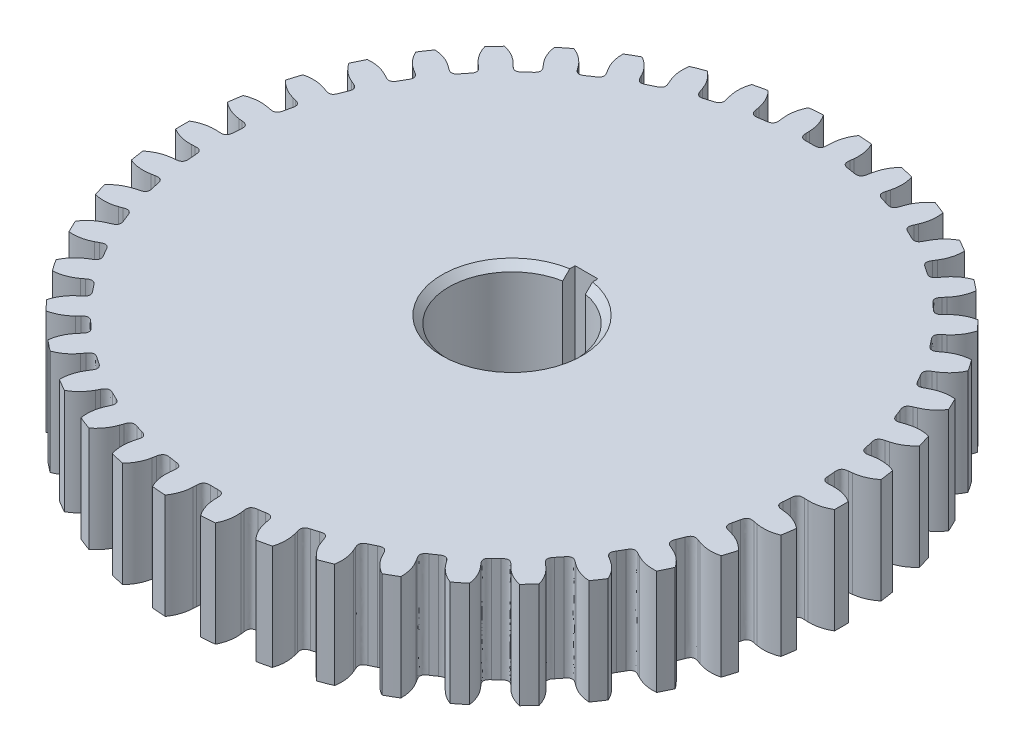
from build123d import *

# Parameters (mm, degrees)
BOSS_EXTRUDE1_DEPTH = 7.5
CIRPATTERN2_START   = -7.5
CIRPATTERN2_DEPTH   = 15
CUT_EXTRUDE1_DEPTH  = 69.092577484
CHAMFER1_SIZE       = 1


with BuildPart() as part:
    # Sketch1 → Boss-Extrude1 (new, symmetric)
    with BuildSketch(Plane(origin=(0, 0, 0), x_dir=(1, 0, 0), z_dir=(0, 1, 0))):
        with BuildLine():
            Line((42.338274669, 3.704119067), (0, 0))
            Line((0, 0), (42.338274669, -3.704119067))
            ThreePointArc((42.338274669, -3.704119067), (42.413791017, -2.705611121), (42.465761792, -1.705601183))
            Line((42.465761792, -1.705601183), (43.964553385, -1.765798871))
            ThreePointArc((43.964553385, -1.765798871), (45.534771559, -1.598199838), (46.989692123, -0.984293735))
            ThreePointArc((46.989692123, -0.984293735), (47, 0), (46.989692123, 0.984293735))
            ThreePointArc((46.989692123, 0.984293735), (45.534771559, 1.598199838), (43.964553385, 1.765798871))
            Line((43.964553385, 1.765798871), (42.465761792, 1.705601183))
            ThreePointArc((42.465761792, 1.705601183), (42.413791017, 2.705611121), (42.338274669, 3.704119067))
        make_face()
    extrude(amount=BOSS_EXTRUDE1_DEPTH, both=True)

    # Fillet1
    # a fillet whose section is not a circle: 1 mm, written as the material it adds along each edge
    with BuildSketch(Plane(origin=(42.465761792, 7.5, -1.705601183), x_dir=(-0.05161489294062093, 0, -0.9986670630529116), z_dir=(0, -1, 0))) as fillet1_piece_1:
        with BuildLine():
            add(Edge.make_bspline([(0.97707605, 0), (0.812105183, 0.001896467), (0.647134316, 0.003792935), (0.283944545, 0.077072663), (0.065709795, 0.295307413), (-0.007569933, 0.658497185), (-0.009466401, 0.823468051), (-0.011362868, 0.988438918)], knots=[0, 0, 0, 0, 0, 0, 0.5, 0.5, 1, 1, 1, 1, 1, 1], degree=5))
            Line((-0.011362868, 0.988438918), (0, 0))
            ThreePointArc((0, 0), (0.488538025, 0.002807968), (0.97707605, 0))
        make_face()
    extrude(amount=15)
    with BuildSketch(Plane(origin=(42.465761792, -7.5, 1.705601183), x_dir=(0.999194395114446, 0, 0.04013179253256076), z_dir=(0, 1, 0))) as fillet1_piece_2:
        with BuildLine():
            add(Edge.make_bspline([(0.988504228, 0), (0.823522461, 0), (0.658540694, 0), (0.294532568, -0.069100016), (0.073803625, -0.284811736), (-0.003646133, -0.64713516), (-0.007438817, -0.812073327), (-0.011231501, -0.977011494)], knots=[0, 0, 0, 0, 0, 0, 0.5, 0.5, 1, 1, 1, 1, 1, 1], degree=5))
            ThreePointArc((-0.011231501, -0.977011494), (-0.002807968, -0.488538025), (0, 0))
            Line((0, 0), (0.988504228, 0))
        make_face()
    extrude(amount=15)

    # CirPattern2: read off the stored shape, not the designer's step
    # CirPattern2 outline → CirPattern2 (add)
    with BuildSketch(Plane(origin=(0, 0, 0), x_dir=(1, 0, 0), z_dir=(0, 1, 0)).offset(CIRPATTERN2_START)):
        with BuildLine():
            add(Edge.make_bspline(
                [(42.338300191, -3.704121242), (42.324988157, -3.860312538), (42.314706675, -4.01940995), (42.357785402, -4.377977118), (42.554149821, -4.608731996), (42.900260677, -4.714580438), (43.064255119, -4.732602822), (43.228249561, -4.750625207)],
                knots=[0.020808919, 0.020808919, 0.020808919, 0.020808919, 0.020808919, 0.020808919, 0.5, 0.5, 1, 1, 1, 1, 1, 1], degree=5))
            Line((42.338300191, -3.704121242), (0, 0))
            Line((0, 0), (42.338300191, 3.704121242))
            add(Edge.make_bspline(
                [(43.228249561, 4.750625207), (43.064255119, 4.732602822), (42.900260677, 4.714580438), (42.554149821, 4.608731996), (42.357785402, 4.377977118), (42.314706675, 4.01940995), (42.324988157, 3.860312538), (42.338300191, 3.704121242)],
                knots=[0, 0, 0, 0, 0, 0, 0.5, 0.5, 0.979191081, 0.979191081, 0.979191081, 0.979191081, 0.979191081, 0.979191081], degree=5))
            Line((43.228249561, 4.750625207), (43.736684314, 4.806500311))
            ThreePointArc((43.736684314, 4.806500311), (45.264385109, 5.206256277), (46.611557455, 6.030150214))
            ThreePointArc((46.611557455, 6.030150214), (46.475048833, 7.00498651), (46.318154718, 7.976750188))
            ThreePointArc((46.318154718, 7.976750188), (44.787986458, 8.36695481), (43.210326983, 8.298653025))
            Line((43.210326983, 8.298653025), (42.708011084, 8.202181981))
            add(Edge.make_bspline(
                [(41.54194774, 8.973103031), (41.576412294, 8.813545659), (41.610309832, 8.652901378), (41.75556126, 8.308686255), (42.014344449, 8.139058355), (42.383969443, 8.139948961), (42.545990264, 8.171065471), (42.708011084, 8.202181981)],
                knots=[0, 0, 0, 0, 0, 0, 0.5, 0.5, 1, 1, 1, 1, 1, 1], degree=5))
            ThreePointArc((41.54194774, 8.973103031), (41.434436268, 9.457139693), (41.32128512, 9.939889136))
            add(Edge.make_bspline(
                [(42.037381784, 11.140400926), (41.877905121, 11.098137733), (41.718428458, 11.055874541), (41.385021426, 10.896302674), (41.225464616, 10.631191399), (41.243946947, 10.258042057), (41.283107262, 10.09859897), (41.32128512, 9.939889136)],
                knots=[0, 0, 0, 0, 0, 0, 0.5, 0.5, 1, 1, 1, 1, 1, 1], degree=5))
            Line((42.037381784, 11.140400926), (42.531809988, 11.271430219))
            ThreePointArc((42.531809988, 11.271430219), (43.982867092, 11.894413229), (45.192197617, 12.909890572))
            ThreePointArc((45.192197617, 12.909890572), (44.911921872, 13.853493197), (44.611946274, 14.791019223))
            ThreePointArc((44.611946274, 14.791019223), (43.040711748, 14.948805836), (41.490853279, 14.646128983))
            Line((41.490853279, 14.646128983), (41.008526097, 14.475869141))
            add(Edge.make_bspline(
                [(39.740586896, 15.064386916), (39.798447302, 14.911748344), (39.85590902, 14.757950493), (40.050840712, 14.43922857), (40.332015233, 14.310064906), (40.697379084, 14.366035312), (40.85295259, 14.420952226), (41.008526097, 14.475869141)],
                knots=[0, 0, 0, 0, 0, 0, 0.5, 0.5, 1, 1, 1, 1, 1, 1], degree=5))
            ThreePointArc((39.740586896, 15.064386916), (39.562134317, 15.526993536), (39.378296903, 15.987486763))
            add(Edge.make_bspline(
                [(39.907468361, 17.281318497), (39.756071923, 17.215758586), (39.604675485, 17.150198675), (39.298775286, 16.942717355), (39.18051338, 16.656786446), (39.254404301, 16.290559522), (39.316890987, 16.138733825), (39.378296903, 15.987486763)],
                knots=[0, 0, 0, 0, 0, 0, 0.5, 0.5, 1, 1, 1, 1, 1, 1], degree=5))
            Line((39.907468361, 17.281318497), (40.376845308, 17.484575001))
            ThreePointArc((40.376845308, 17.484575001), (41.718844504, 18.316868645), (42.763318761, 19.501245307))
            ThreePointArc((42.763318761, 19.501245307), (42.345536791, 20.392535738), (41.90918067, 21.27488133))
            ThreePointArc((41.90918067, 21.27488133), (40.33197866, 21.196725243), (38.844542474, 20.666434621))
            Line((38.844542474, 20.666434621), (38.392978401, 20.426189305))
            add(Edge.make_bspline(
                [(37.05148701, 20.819157291), (37.131450763, 20.676847212), (37.211193061, 20.53333138), (37.451450564, 20.247222379), (37.748735443, 20.161408254), (38.101676526, 20.271208173), (38.247327463, 20.348698739), (38.392978401, 20.426189305)],
                knots=[0, 0, 0, 0, 0, 0, 0.5, 0.5, 1, 1, 1, 1, 1, 1], degree=5))
            ThreePointArc((37.05148701, 20.819157291), (36.806079661, 21.25), (36.555662605, 21.677950353))
            add(Edge.make_bspline(
                [(36.886088041, 23.03619997), (36.746153774, 22.94880784), (36.606219506, 22.861415711), (36.334659446, 22.610659728), (36.260334218, 22.310296407), (36.38798313, 21.959172806), (36.472400337, 21.818356034), (36.555662605, 21.677950353)],
                knots=[0, 0, 0, 0, 0, 0, 0.5, 0.5, 1, 1, 1, 1, 1, 1], degree=5))
            Line((36.886088041, 23.03619997), (37.319928625, 23.30714327))
            ThreePointArc((37.319928625, 23.30714327), (38.522891868, 24.330155483), (39.379178029, 25.656974447))
            ThreePointArc((39.379178029, 25.656974447), (38.833222393, 26.476042729), (38.270233222, 27.283497744))
            ThreePointArc((38.270233222, 27.283497744), (36.722295816, 26.971144834), (35.330508779, 26.225086261))
            Line((35.330508779, 26.225086261), (34.91979501, 25.920222153))
            add(Edge.make_bspline(
                [(33.534718131, 26.108862095), (33.634998971, 25.98005948), (33.735240538, 25.850031575), (34.015456897, 25.602926697), (34.322211282, 25.562379058), (34.654845475, 25.723555741), (34.787320243, 25.821888947), (34.91979501, 25.920222153)],
                knots=[0, 0, 0, 0, 0, 0, 0.5, 0.5, 1, 1, 1, 1, 1, 1], degree=5))
            ThreePointArc((33.534718131, 26.108862095), (33.227838005, 26.498316579), (32.91643521, 26.884164355))
            add(Edge.make_bspline(
                [(33.040733466, 28.276490801), (32.91538727, 28.169218649), (32.790041074, 28.061946498), (32.558887355, 27.773517324), (32.530159109, 27.465431214), (32.708714545, 27.137254456), (32.813176532, 27.010592223), (32.91643521, 26.884164355)],
                knots=[0, 0, 0, 0, 0, 0, 0.5, 0.5, 1, 1, 1, 1, 1, 1], degree=5))
            Line((33.040733466, 28.276490801), (33.429346406, 28.609068473))
            ThreePointArc((33.429346406, 28.609068473), (34.466401484, 29.799946853), (35.115371532, 31.239569174))
            ThreePointArc((35.115371532, 31.239569174), (34.453437976, 31.968118675), (33.776392004, 32.682645903))
            ThreePointArc((33.776392004, 32.682645903), (32.292297566, 32.143073618), (31.0272499, 31.197912809))
            Line((31.0272499, 31.197912809), (30.666561102, 30.83524007))
            add(Edge.make_bspline(
                [(29.268839063, 30.815338063), (29.387196882, 30.702920151), (29.505698488, 30.58928478), (29.819614132, 30.386703941), (30.128985636, 30.392328554), (30.433882442, 30.60128158), (30.550221772, 30.718260825), (30.666561102, 30.83524007)],
                knots=[0, 0, 0, 0, 0, 0, 0.5, 0.5, 1, 1, 1, 1, 1, 1], degree=5))
            ThreePointArc((29.268839063, 30.815338063), (28.907341355, 31.154704553), (28.541909045, 31.48983055))
            add(Edge.make_bspline(
                [(28.457303504, 32.885131553), (28.349345406, 32.760375662), (28.241387307, 32.635619771), (28.055803523, 32.315960439), (28.073313999, 32.007033673), (28.298787326, 31.709134685), (28.420960586, 31.599456415), (28.541909045, 31.48983055)],
                knots=[0, 0, 0, 0, 0, 0, 0.5, 0.5, 1, 1, 1, 1, 1, 1], degree=5))
            Line((28.457303504, 32.885131553), (28.792007828, 33.271914361))
            ThreePointArc((28.792007828, 33.271914361), (29.639988646, 34.604056652), (30.067145661, 36.124323548))
            ThreePointArc((30.067145661, 36.124323548), (29.304020687, 36.746079676), (28.528042002, 37.351717759))
            ThreePointArc((28.528042002, 37.351717759), (27.140942749, 36.596979253), (26.030893529, 35.473829538))
            Line((26.030893529, 35.473829538), (25.728286894, 35.061449678))
            add(Edge.make_bspline(
                [(24.349142495, 34.833450299), (24.482933376, 34.73992832), (24.61704789, 34.64522391), (24.957650463, 34.491692431), (25.262728238, 34.543363651), (25.533076766, 34.795425356), (25.63068183, 34.928437517), (25.728286894, 35.061449678)],
                knots=[0, 0, 0, 0, 0, 0, 0.5, 0.5, 1, 1, 1, 1, 1, 1], degree=5))
            ThreePointArc((24.349142495, 34.833450299), (23.941102468, 35.115147908), (23.529803797, 35.392065965))
            add(Edge.make_bspline(
                [(23.238184406, 36.759172808), (23.150026011, 36.619720017), (23.061867616, 36.480267227), (22.9259994, 36.136518397), (22.989357444, 35.833651889), (23.256711961, 35.572685242), (23.393867344, 35.482440968), (23.529803797, 35.392065965)],
                knots=[0, 0, 0, 0, 0, 0, 0.5, 0.5, 1, 1, 1, 1, 1, 1], degree=5))
            Line((23.238184406, 36.759172808), (23.511503373, 37.191520662))
            ThreePointArc((23.511503373, 37.191520662), (24.15146744, 38.635169007), (24.347269441, 40.202120228))
            ThreePointArc((24.347269441, 40.202120228), (23.5, 40.703193978), (22.642422683, 41.186413962))
            ThreePointArc((22.642422683, 41.186413962), (21.38330412, 40.233368845), (20.453050012, 38.957319533))
            Line((20.453050012, 38.957319533), (20.215285271, 38.504444437))
            add(Edge.make_bspline(
                [(18.88552632, 38.073440817), (19.031761595, 38.000903897), (19.17849312, 37.927245988), (19.538174124, 37.826193508), (19.832143236, 37.922757086), (20.061904347, 38.212296828), (20.138594809, 38.358370632), (20.215285271, 38.504444437)],
                knots=[0, 0, 0, 0, 0, 0, 0.5, 0.5, 1, 1, 1, 1, 1, 1], degree=5))
            ThreePointArc((18.88552632, 38.073440817), (18.440058912, 38.291176886), (17.992081613, 38.503701111))
            add(Edge.make_bspline(
                [(17.499962668, 39.812074885), (17.433573289, 39.661040339), (17.367183911, 39.510005794), (17.284066335, 39.149846249), (17.391856633, 38.859805536), (17.695120081, 38.641600794), (17.844193763, 38.572806423), (17.992081613, 38.503701111)],
                knots=[0, 0, 0, 0, 0, 0, 0.5, 0.5, 1, 1, 1, 1, 1, 1], degree=5))
            Line((17.499962668, 39.812074885), (17.705790784, 40.280329848))
            ThreePointArc((17.705790784, 40.280329848), (18.12344236, 41.803235529), (18.083515453, 43.381867973))
            ThreePointArc((18.083515453, 43.381867973), (17.171028145, 43.751066186), (16.251009057, 44.101073736))
            ThreePointArc((16.251009057, 44.101073736), (15.147997812, 42.971011462), (14.418319155, 41.570567386))
            Line((14.418319155, 41.570567386), (14.25070758, 41.087313534))
            add(Edge.make_bspline(
                [(13.000038694, 40.462933581), (13.155451709, 40.413002075), (13.311522506, 40.362036063), (13.682247261, 40.315719928), (13.958540926, 40.455018794), (14.142582136, 40.775568732), (14.196644858, 40.931441133), (14.25070758, 41.087313534)],
                knots=[0, 0, 0, 0, 0, 0, 0.5, 0.5, 1, 1, 1, 1, 1, 1], degree=5))
            ThreePointArc((13.000038694, 40.462933581), (12.527094912, 40.611844246), (12.052446057, 40.755227199))
            add(Edge.make_bspline(
                [(11.370820682, 41.975640996), (11.327683349, 41.816398558), (11.284546016, 41.657156121), (11.25603579, 41.288631228), (11.405850484, 41.01789534), (11.738248459, 40.847326837), (11.89591038, 40.801519121), (12.052446057, 40.755227199)],
                knots=[0, 0, 0, 0, 0, 0, 0.5, 0.5, 1, 1, 1, 1, 1, 1], degree=5))
            Line((11.370820682, 41.975640996), (11.504560087, 42.469343028))
            ThreePointArc((11.504560087, 42.469343028), (11.690569526, 44.037486848), (11.415805613, 45.592536475))
            ThreePointArc((11.415805613, 45.592536475), (10.458483896, 45.821611873), (9.496574742, 46.030588397))
            ThreePointArc((9.496574742, 46.030588397), (8.574310263, 44.748752689), (8.061506873, 43.255197456))
            Line((8.061506873, 43.255197456), (7.96779263, 42.752359942))
            add(Edge.make_bspline(
                [(6.824151686, 41.948551271), (6.98527077, 41.922340567), (7.147194476, 41.895204949), (7.520681603, 41.904659784), (7.773127878, 42.083582231), (7.90733801, 42.42798181), (7.93756532, 42.590170876), (7.96779263, 42.752359942)],
                knots=[0, 0, 0, 0, 0, 0, 0.5, 0.5, 1, 1, 1, 1, 1, 1], degree=5))
            ThreePointArc((6.824151686, 41.948551271), (6.334296313, 42.025310115), (5.843578773, 42.096348857))
            add(Edge.make_bspline(
                [(4.987673351, 43.20154065), (4.968751681, 43.037647533), (4.94983001, 42.873754416), (4.976564004, 42.505096413), (5.165056483, 42.259713143), (5.519163763, 42.140591096), (5.681892017, 42.118793305), (5.843578773, 42.096348857)],
                knots=[0, 0, 0, 0, 0, 0, 0.5, 0.5, 1, 1, 1, 1, 1, 1], degree=5))
            Line((4.987673351, 43.20154065), (5.046336529, 43.709661262))
            ThreePointArc((5.046336529, 43.709661262), (4.996548687, 45.288013479), (4.49308554, 46.784743051))
            ThreePointArc((4.49308554, 46.784743051), (3.512314399, 46.868578468), (2.53000264, 46.931855777))
            ThreePointArc((2.53000264, 46.931855777), (1.809086793, 45.526880726), (1.524613849, 43.973577892))
            Line((1.524613849, 43.973577892), (1.50689036, 43.462389274))
            add(Edge.make_bspline(
                [(0.495824406, 42.497107645), (0.659050426, 42.495203246), (0.823209931, 42.492504186), (1.191116346, 42.557518786), (1.414075997, 42.772067982), (1.49545702, 43.132623885), (1.50117369, 43.29750658), (1.50689036, 43.462389274)],
                knots=[0, 0, 0, 0, 0, 0, 0.5, 0.5, 1, 1, 1, 1, 1, 1], degree=5))
            ThreePointArc((0.495824406, 42.497107645), (0, 42.5), (-0.495824406, 42.497107645))
            add(Edge.make_bspline(
                [(-1.50689036, 43.462389274), (-1.50117369, 43.29750658), (-1.49545702, 43.132623885), (-1.414075997, 42.772067982), (-1.191116346, 42.557518786), (-0.823209931, 42.492504186), (-0.659050426, 42.495203246), (-0.495824406, 42.497107645)],
                knots=[0, 0, 0, 0, 0, 0, 0.5, 0.5, 1, 1, 1, 1, 1, 1], degree=5))
            Line((-1.50689036, 43.462389274), (-1.524613849, 43.973577892))
            ThreePointArc((-1.524613849, 43.973577892), (-1.809086793, 45.526880726), (-2.53000264, 46.931855777))
            ThreePointArc((-2.53000264, 46.931855777), (-3.512314399, 46.868578468), (-4.49308554, 46.784743051))
            ThreePointArc((-4.49308554, 46.784743051), (-4.996548687, 45.288013479), (-5.046336529, 43.709661262))
            Line((-5.046336529, 43.709661262), (-4.987673351, 43.20154065))
            add(Edge.make_bspline(
                [(-5.843578773, 42.096348857), (-5.681892017, 42.118793305), (-5.519163763, 42.140591096), (-5.165056483, 42.259713143), (-4.976564004, 42.505096413), (-4.94983001, 42.873754416), (-4.968751681, 43.037647533), (-4.987673351, 43.20154065)],
                knots=[0, 0, 0, 0, 0, 0, 0.5, 0.5, 1, 1, 1, 1, 1, 1], degree=5))
            ThreePointArc((-5.843578773, 42.096348857), (-6.334296313, 42.025310115), (-6.824151686, 41.948551271))
            add(Edge.make_bspline(
                [(-7.96779263, 42.752359942), (-7.93756532, 42.590170876), (-7.90733801, 42.42798181), (-7.773127878, 42.083582231), (-7.520681603, 41.904659784), (-7.147194476, 41.895204949), (-6.98527077, 41.922340567), (-6.824151686, 41.948551271)],
                knots=[0, 0, 0, 0, 0, 0, 0.5, 0.5, 1, 1, 1, 1, 1, 1], degree=5))
            Line((-7.96779263, 42.752359942), (-8.061506873, 43.255197456))
            ThreePointArc((-8.061506873, 43.255197456), (-8.574310263, 44.748752689), (-9.496574742, 46.030588397))
            ThreePointArc((-9.496574742, 46.030588397), (-10.458483896, 45.821611873), (-11.415805613, 45.592536475))
            ThreePointArc((-11.415805613, 45.592536475), (-11.690569526, 44.037486848), (-11.504560087, 42.469343028))
            Line((-11.504560087, 42.469343028), (-11.370820682, 41.975640996))
            add(Edge.make_bspline(
                [(-12.052446057, 40.755227199), (-11.89591038, 40.801519121), (-11.738248459, 40.847326837), (-11.405850484, 41.01789534), (-11.25603579, 41.288631228), (-11.284546016, 41.657156121), (-11.327683349, 41.816398558), (-11.370820682, 41.975640996)],
                knots=[0, 0, 0, 0, 0, 0, 0.5, 0.5, 1, 1, 1, 1, 1, 1], degree=5))
            ThreePointArc((-12.052446057, 40.755227199), (-12.527094912, 40.611844246), (-13.000038694, 40.462933581))
            add(Edge.make_bspline(
                [(-14.25070758, 41.087313534), (-14.196644858, 40.931441133), (-14.142582136, 40.775568732), (-13.958540926, 40.455018794), (-13.682247261, 40.315719928), (-13.311522506, 40.362036063), (-13.155451709, 40.413002075), (-13.000038694, 40.462933581)],
                knots=[0, 0, 0, 0, 0, 0, 0.5, 0.5, 1, 1, 1, 1, 1, 1], degree=5))
            Line((-14.25070758, 41.087313534), (-14.418319155, 41.570567386))
            ThreePointArc((-14.418319155, 41.570567386), (-15.147997812, 42.971011462), (-16.251009057, 44.101073736))
            ThreePointArc((-16.251009057, 44.101073736), (-17.171028145, 43.751066186), (-18.083515453, 43.381867973))
            ThreePointArc((-18.083515453, 43.381867973), (-18.12344236, 41.803235529), (-17.705790784, 40.280329848))
            Line((-17.705790784, 40.280329848), (-17.499962668, 39.812074885))
            add(Edge.make_bspline(
                [(-17.992081613, 38.503701111), (-17.844193763, 38.572806423), (-17.695120081, 38.641600794), (-17.391856633, 38.859805536), (-17.284066335, 39.149846249), (-17.367183911, 39.510005794), (-17.433573289, 39.661040339), (-17.499962668, 39.812074885)],
                knots=[0, 0, 0, 0, 0, 0, 0.5, 0.5, 1, 1, 1, 1, 1, 1], degree=5))
            ThreePointArc((-17.992081613, 38.503701111), (-18.440058912, 38.291176886), (-18.88552632, 38.073440817))
            add(Edge.make_bspline(
                [(-20.215285271, 38.504444437), (-20.138594809, 38.358370632), (-20.061904347, 38.212296828), (-19.832143236, 37.922757086), (-19.538174124, 37.826193508), (-19.17849312, 37.927245988), (-19.031761595, 38.000903897), (-18.88552632, 38.073440817)],
                knots=[0, 0, 0, 0, 0, 0, 0.5, 0.5, 1, 1, 1, 1, 1, 1], degree=5))
            Line((-20.215285271, 38.504444437), (-20.453050012, 38.957319533))
            ThreePointArc((-20.453050012, 38.957319533), (-21.38330412, 40.233368845), (-22.642422683, 41.186413962))
            ThreePointArc((-22.642422683, 41.186413962), (-23.5, 40.703193978), (-24.347269441, 40.202120228))
            ThreePointArc((-24.347269441, 40.202120228), (-24.15146744, 38.635169007), (-23.511503373, 37.191520662))
            Line((-23.511503373, 37.191520662), (-23.238184406, 36.759172808))
            add(Edge.make_bspline(
                [(-23.529803797, 35.392065965), (-23.393867344, 35.482440968), (-23.256711961, 35.572685242), (-22.989357444, 35.833651889), (-22.9259994, 36.136518397), (-23.061867616, 36.480267227), (-23.150026011, 36.619720017), (-23.238184406, 36.759172808)],
                knots=[0, 0, 0, 0, 0, 0, 0.5, 0.5, 1, 1, 1, 1, 1, 1], degree=5))
            ThreePointArc((-23.529803797, 35.392065965), (-23.941102468, 35.115147908), (-24.349142495, 34.833450299))
            add(Edge.make_bspline(
                [(-25.728286894, 35.061449678), (-25.63068183, 34.928437517), (-25.533076766, 34.795425356), (-25.262728238, 34.543363651), (-24.957650463, 34.491692431), (-24.61704789, 34.64522391), (-24.482933376, 34.73992832), (-24.349142495, 34.833450299)],
                knots=[0, 0, 0, 0, 0, 0, 0.5, 0.5, 1, 1, 1, 1, 1, 1], degree=5))
            Line((-25.728286894, 35.061449678), (-26.030893529, 35.473829538))
            ThreePointArc((-26.030893529, 35.473829538), (-27.140942749, 36.596979253), (-28.528042002, 37.351717759))
            ThreePointArc((-28.528042002, 37.351717759), (-29.304020687, 36.746079676), (-30.067145661, 36.124323548))
            ThreePointArc((-30.067145661, 36.124323548), (-29.639988646, 34.604056652), (-28.792007828, 33.271914361))
            Line((-28.792007828, 33.271914361), (-28.457303504, 32.885131553))
            add(Edge.make_bspline(
                [(-28.541909045, 31.48983055), (-28.420960586, 31.599456415), (-28.298787326, 31.709134685), (-28.073313999, 32.007033673), (-28.055803523, 32.315960439), (-28.241387307, 32.635619771), (-28.349345406, 32.760375662), (-28.457303504, 32.885131553)],
                knots=[0, 0, 0, 0, 0, 0, 0.5, 0.5, 1, 1, 1, 1, 1, 1], degree=5))
            ThreePointArc((-28.541909045, 31.48983055), (-28.907341355, 31.154704553), (-29.268839063, 30.815338063))
            add(Edge.make_bspline(
                [(-30.666561102, 30.83524007), (-30.550221772, 30.718260825), (-30.433882442, 30.60128158), (-30.128985636, 30.392328554), (-29.819614132, 30.386703941), (-29.505698488, 30.58928478), (-29.387196882, 30.702920151), (-29.268839063, 30.815338063)],
                knots=[0, 0, 0, 0, 0, 0, 0.5, 0.5, 1, 1, 1, 1, 1, 1], degree=5))
            Line((-30.666561102, 30.83524007), (-31.0272499, 31.197912809))
            ThreePointArc((-31.0272499, 31.197912809), (-32.292297566, 32.143073618), (-33.776392004, 32.682645903))
            ThreePointArc((-33.776392004, 32.682645903), (-34.453437976, 31.968118675), (-35.115371532, 31.239569174))
            ThreePointArc((-35.115371532, 31.239569174), (-34.466401484, 29.799946853), (-33.429346406, 28.609068473))
            Line((-33.429346406, 28.609068473), (-33.040733466, 28.276490801))
            add(Edge.make_bspline(
                [(-32.91643521, 26.884164355), (-32.813176532, 27.010592223), (-32.708714545, 27.137254456), (-32.530159109, 27.465431214), (-32.558887355, 27.773517324), (-32.790041074, 28.061946498), (-32.91538727, 28.169218649), (-33.040733466, 28.276490801)],
                knots=[0, 0, 0, 0, 0, 0, 0.5, 0.5, 1, 1, 1, 1, 1, 1], degree=5))
            ThreePointArc((-32.91643521, 26.884164355), (-33.227838005, 26.498316579), (-33.534718131, 26.108862095))
            add(Edge.make_bspline(
                [(-34.91979501, 25.920222153), (-34.787320243, 25.821888947), (-34.654845475, 25.723555741), (-34.322211282, 25.562379058), (-34.015456897, 25.602926697), (-33.735240538, 25.850031575), (-33.634998971, 25.98005948), (-33.534718131, 26.108862095)],
                knots=[0, 0, 0, 0, 0, 0, 0.5, 0.5, 1, 1, 1, 1, 1, 1], degree=5))
            Line((-34.91979501, 25.920222153), (-35.330508779, 26.225086261))
            ThreePointArc((-35.330508779, 26.225086261), (-36.722295816, 26.971144834), (-38.270233222, 27.283497744))
            ThreePointArc((-38.270233222, 27.283497744), (-38.833222393, 26.476042729), (-39.379178029, 25.656974447))
            ThreePointArc((-39.379178029, 25.656974447), (-38.522891868, 24.330155483), (-37.319928625, 23.30714327))
            Line((-37.319928625, 23.30714327), (-36.886088041, 23.03619997))
            add(Edge.make_bspline(
                [(-36.555662605, 21.677950353), (-36.472400337, 21.818356034), (-36.38798313, 21.959172806), (-36.260334218, 22.310296407), (-36.334659446, 22.610659728), (-36.606219506, 22.861415711), (-36.746153774, 22.94880784), (-36.886088041, 23.03619997)],
                knots=[0, 0, 0, 0, 0, 0, 0.5, 0.5, 1, 1, 1, 1, 1, 1], degree=5))
            ThreePointArc((-36.555662605, 21.677950353), (-36.806079661, 21.25), (-37.05148701, 20.819157291))
            add(Edge.make_bspline(
                [(-38.392978401, 20.426189305), (-38.247327463, 20.348698739), (-38.101676526, 20.271208173), (-37.748735443, 20.161408254), (-37.451450564, 20.247222379), (-37.211193061, 20.53333138), (-37.131450763, 20.676847212), (-37.05148701, 20.819157291)],
                knots=[0, 0, 0, 0, 0, 0, 0.5, 0.5, 1, 1, 1, 1, 1, 1], degree=5))
            Line((-38.392978401, 20.426189305), (-38.844542474, 20.666434621))
            ThreePointArc((-38.844542474, 20.666434621), (-40.33197866, 21.196725243), (-41.90918067, 21.27488133))
            ThreePointArc((-41.90918067, 21.27488133), (-42.345536791, 20.392535738), (-42.763318761, 19.501245307))
            ThreePointArc((-42.763318761, 19.501245307), (-41.718844504, 18.316868645), (-40.376845308, 17.484575001))
            Line((-40.376845308, 17.484575001), (-39.907468361, 17.281318497))
            add(Edge.make_bspline(
                [(-39.378296903, 15.987486763), (-39.316890987, 16.138733825), (-39.254404301, 16.290559522), (-39.18051338, 16.656786446), (-39.298775286, 16.942717355), (-39.604675485, 17.150198675), (-39.756071923, 17.215758586), (-39.907468361, 17.281318497)],
                knots=[0, 0, 0, 0, 0, 0, 0.5, 0.5, 1, 1, 1, 1, 1, 1], degree=5))
            ThreePointArc((-39.378296903, 15.987486763), (-39.562134317, 15.526993536), (-39.740586896, 15.064386916))
            add(Edge.make_bspline(
                [(-41.008526097, 14.475869141), (-40.85295259, 14.420952226), (-40.697379084, 14.366035312), (-40.332015233, 14.310064906), (-40.050840712, 14.43922857), (-39.85590902, 14.757950493), (-39.798447302, 14.911748344), (-39.740586896, 15.064386916)],
                knots=[0, 0, 0, 0, 0, 0, 0.5, 0.5, 1, 1, 1, 1, 1, 1], degree=5))
            Line((-41.008526097, 14.475869141), (-41.490853279, 14.646128983))
            ThreePointArc((-41.490853279, 14.646128983), (-43.040711748, 14.948805836), (-44.611946274, 14.791019223))
            ThreePointArc((-44.611946274, 14.791019223), (-44.911921872, 13.853493197), (-45.192197617, 12.909890572))
            ThreePointArc((-45.192197617, 12.909890572), (-43.982867092, 11.894413229), (-42.531809988, 11.271430219))
            Line((-42.531809988, 11.271430219), (-42.037381784, 11.140400926))
            add(Edge.make_bspline(
                [(-41.32128512, 9.939889136), (-41.283107262, 10.09859897), (-41.243946947, 10.258042057), (-41.225464616, 10.631191399), (-41.385021426, 10.896302674), (-41.718428458, 11.055874541), (-41.877905121, 11.098137733), (-42.037381784, 11.140400926)],
                knots=[0, 0, 0, 0, 0, 0, 0.5, 0.5, 1, 1, 1, 1, 1, 1], degree=5))
            ThreePointArc((-41.32128512, 9.939889136), (-41.434436268, 9.457139693), (-41.54194774, 8.973103031))
            add(Edge.make_bspline(
                [(-42.708011084, 8.202181981), (-42.545990264, 8.171065471), (-42.383969443, 8.139948961), (-42.014344449, 8.139058355), (-41.75556126, 8.308686255), (-41.610309832, 8.652901378), (-41.576412294, 8.813545659), (-41.54194774, 8.973103031)],
                knots=[0, 0, 0, 0, 0, 0, 0.5, 0.5, 1, 1, 1, 1, 1, 1], degree=5))
            Line((-42.708011084, 8.202181981), (-43.210326983, 8.298653025))
            ThreePointArc((-43.210326983, 8.298653025), (-44.787986458, 8.36695481), (-46.318154718, 7.976750188))
            ThreePointArc((-46.318154718, 7.976750188), (-46.475048833, 7.00498651), (-46.611557455, 6.030150214))
            ThreePointArc((-46.611557455, 6.030150214), (-45.264385109, 5.206256277), (-43.736684314, 4.806500311))
            Line((-43.736684314, 4.806500311), (-43.228249561, 4.750625207))
            add(Edge.make_bspline(
                [(-42.341224108, 3.670250811), (-42.327127139, 3.832878102), (-42.312167971, 3.996376884), (-42.349507096, 4.368113105), (-42.546794573, 4.606482597), (-42.900260677, 4.714580438), (-43.064255119, 4.732602822), (-43.228249561, 4.750625207)],
                knots=[0, 0, 0, 0, 0, 0, 0.5, 0.5, 1, 1, 1, 1, 1, 1], degree=5))
            ThreePointArc((-42.341224108, 3.670250811), (-42.38116138, 3.176028977), (-42.415330117, 2.681374851))
            add(Edge.make_bspline(
                [(-43.453469677, 1.745271629), (-43.28862082, 1.738650615), (-43.123771963, 1.732029601), (-42.758142637, 1.786238689), (-42.527531568, 1.992541619), (-42.435205081, 2.354560745), (-42.425628939, 2.518462929), (-42.415330117, 2.681374851)],
                knots=[0, 0, 0, 0, 0, 0, 0.5, 0.5, 1, 1, 1, 1, 1, 1], degree=5))
            Line((-43.453469677, 1.745271629), (-43.964553385, 1.765798871))
            ThreePointArc((-43.964553385, 1.765798871), (-45.534771559, 1.598199838), (-46.989692123, 0.984293735))
            ThreePointArc((-46.989692123, 0.984293735), (-47, 0), (-46.989692123, -0.984293735))
            ThreePointArc((-46.989692123, -0.984293735), (-45.534771559, -1.598199838), (-43.964553385, -1.765798871))
            Line((-43.964553385, -1.765798871), (-43.453469677, -1.745271629))
            add(Edge.make_bspline(
                [(-42.415330117, -2.681374851), (-42.425628939, -2.518462929), (-42.435205081, -2.354560745), (-42.527531568, -1.992541619), (-42.758142637, -1.786238689), (-43.123771963, -1.732029601), (-43.28862082, -1.738650615), (-43.453469677, -1.745271629)],
                knots=[0, 0, 0, 0, 0, 0, 0.5, 0.5, 1, 1, 1, 1, 1, 1], degree=5))
            ThreePointArc((-42.415330117, -2.681374851), (-42.38116138, -3.176028977), (-42.341224108, -3.670250811))
            add(Edge.make_bspline(
                [(-43.228249561, -4.750625207), (-43.064255119, -4.732602822), (-42.900260677, -4.714580438), (-42.546794573, -4.606482597), (-42.349507096, -4.368113105), (-42.312167971, -3.996376884), (-42.327127139, -3.832878102), (-42.341224108, -3.670250811)],
                knots=[0, 0, 0, 0, 0, 0, 0.5, 0.5, 1, 1, 1, 1, 1, 1], degree=5))
            Line((-43.228249561, -4.750625207), (-43.736684314, -4.806500311))
            ThreePointArc((-43.736684314, -4.806500311), (-45.264385109, -5.206256277), (-46.611557455, -6.030150214))
            ThreePointArc((-46.611557455, -6.030150214), (-46.475048833, -7.00498651), (-46.318154718, -7.976750188))
            ThreePointArc((-46.318154718, -7.976750188), (-44.787986458, -8.36695481), (-43.210326983, -8.298653025))
            Line((-43.210326983, -8.298653025), (-42.708011084, -8.202181981))
            add(Edge.make_bspline(
                [(-41.54194774, -8.973103031), (-41.576412294, -8.813545659), (-41.610309832, -8.652901378), (-41.75556126, -8.308686255), (-42.014344449, -8.139058355), (-42.383969443, -8.139948961), (-42.545990264, -8.171065471), (-42.708011084, -8.202181981)],
                knots=[0, 0, 0, 0, 0, 0, 0.5, 0.5, 1, 1, 1, 1, 1, 1], degree=5))
            ThreePointArc((-41.54194774, -8.973103031), (-41.434436268, -9.457139693), (-41.32128512, -9.939889136))
            add(Edge.make_bspline(
                [(-42.037381784, -11.140400926), (-41.877905121, -11.098137733), (-41.718428458, -11.055874541), (-41.385021426, -10.896302674), (-41.225464616, -10.631191399), (-41.243946947, -10.258042057), (-41.283107262, -10.09859897), (-41.32128512, -9.939889136)],
                knots=[0, 0, 0, 0, 0, 0, 0.5, 0.5, 1, 1, 1, 1, 1, 1], degree=5))
            Line((-42.037381784, -11.140400926), (-42.531809988, -11.271430219))
            ThreePointArc((-42.531809988, -11.271430219), (-43.982867092, -11.894413229), (-45.192197617, -12.909890572))
            ThreePointArc((-45.192197617, -12.909890572), (-44.911921872, -13.853493197), (-44.611946274, -14.791019223))
            ThreePointArc((-44.611946274, -14.791019223), (-43.040711748, -14.948805836), (-41.490853279, -14.646128983))
            Line((-41.490853279, -14.646128983), (-41.008526097, -14.475869141))
            add(Edge.make_bspline(
                [(-39.740586896, -15.064386916), (-39.798447302, -14.911748344), (-39.85590902, -14.757950493), (-40.050840712, -14.43922857), (-40.332015233, -14.310064906), (-40.697379084, -14.366035312), (-40.85295259, -14.420952226), (-41.008526097, -14.475869141)],
                knots=[0, 0, 0, 0, 0, 0, 0.5, 0.5, 1, 1, 1, 1, 1, 1], degree=5))
            ThreePointArc((-39.740586896, -15.064386916), (-39.562134317, -15.526993536), (-39.378296903, -15.987486763))
            add(Edge.make_bspline(
                [(-39.907468361, -17.281318497), (-39.756071923, -17.215758586), (-39.604675485, -17.150198675), (-39.298775286, -16.942717355), (-39.18051338, -16.656786446), (-39.254404301, -16.290559522), (-39.316890987, -16.138733825), (-39.378296903, -15.987486763)],
                knots=[0, 0, 0, 0, 0, 0, 0.5, 0.5, 1, 1, 1, 1, 1, 1], degree=5))
            Line((-39.907468361, -17.281318497), (-40.376845308, -17.484575001))
            ThreePointArc((-40.376845308, -17.484575001), (-41.718844504, -18.316868645), (-42.763318761, -19.501245307))
            ThreePointArc((-42.763318761, -19.501245307), (-42.345536791, -20.392535738), (-41.90918067, -21.27488133))
            ThreePointArc((-41.90918067, -21.27488133), (-40.33197866, -21.196725243), (-38.844542474, -20.666434621))
            Line((-38.844542474, -20.666434621), (-38.392978401, -20.426189305))
            add(Edge.make_bspline(
                [(-37.05148701, -20.819157291), (-37.131450763, -20.676847212), (-37.211193061, -20.53333138), (-37.451450564, -20.247222379), (-37.748735443, -20.161408254), (-38.101676526, -20.271208173), (-38.247327463, -20.348698739), (-38.392978401, -20.426189305)],
                knots=[0, 0, 0, 0, 0, 0, 0.5, 0.5, 1, 1, 1, 1, 1, 1], degree=5))
            ThreePointArc((-37.05148701, -20.819157291), (-36.806079661, -21.25), (-36.555662605, -21.677950353))
            add(Edge.make_bspline(
                [(-36.886088041, -23.03619997), (-36.746153774, -22.94880784), (-36.606219506, -22.861415711), (-36.334659446, -22.610659728), (-36.260334218, -22.310296407), (-36.38798313, -21.959172806), (-36.472400337, -21.818356034), (-36.555662605, -21.677950353)],
                knots=[0, 0, 0, 0, 0, 0, 0.5, 0.5, 1, 1, 1, 1, 1, 1], degree=5))
            Line((-36.886088041, -23.03619997), (-37.319928625, -23.30714327))
            ThreePointArc((-37.319928625, -23.30714327), (-38.522891868, -24.330155483), (-39.379178029, -25.656974447))
            ThreePointArc((-39.379178029, -25.656974447), (-38.833222393, -26.476042729), (-38.270233222, -27.283497744))
            ThreePointArc((-38.270233222, -27.283497744), (-36.722295816, -26.971144834), (-35.330508779, -26.225086261))
            Line((-35.330508779, -26.225086261), (-34.91979501, -25.920222153))
            add(Edge.make_bspline(
                [(-33.534718131, -26.108862095), (-33.634998971, -25.98005948), (-33.735240538, -25.850031575), (-34.015456897, -25.602926697), (-34.322211282, -25.562379058), (-34.654845475, -25.723555741), (-34.787320243, -25.821888947), (-34.91979501, -25.920222153)],
                knots=[0, 0, 0, 0, 0, 0, 0.5, 0.5, 1, 1, 1, 1, 1, 1], degree=5))
            ThreePointArc((-33.534718131, -26.108862095), (-33.227838005, -26.498316579), (-32.91643521, -26.884164355))
            add(Edge.make_bspline(
                [(-33.040733466, -28.276490801), (-32.91538727, -28.169218649), (-32.790041074, -28.061946498), (-32.558887355, -27.773517324), (-32.530159109, -27.465431214), (-32.708714545, -27.137254456), (-32.813176532, -27.010592223), (-32.91643521, -26.884164355)],
                knots=[0, 0, 0, 0, 0, 0, 0.5, 0.5, 1, 1, 1, 1, 1, 1], degree=5))
            Line((-33.040733466, -28.276490801), (-33.429346406, -28.609068473))
            ThreePointArc((-33.429346406, -28.609068473), (-34.466401484, -29.799946853), (-35.115371532, -31.239569174))
            ThreePointArc((-35.115371532, -31.239569174), (-34.453437976, -31.968118675), (-33.776392004, -32.682645903))
            ThreePointArc((-33.776392004, -32.682645903), (-32.292297566, -32.143073618), (-31.0272499, -31.197912809))
            Line((-31.0272499, -31.197912809), (-30.666561102, -30.83524007))
            add(Edge.make_bspline(
                [(-29.268839063, -30.815338063), (-29.387196882, -30.702920151), (-29.505698488, -30.58928478), (-29.819614132, -30.386703941), (-30.128985636, -30.392328554), (-30.433882442, -30.60128158), (-30.550221772, -30.718260825), (-30.666561102, -30.83524007)],
                knots=[0, 0, 0, 0, 0, 0, 0.5, 0.5, 1, 1, 1, 1, 1, 1], degree=5))
            ThreePointArc((-29.268839063, -30.815338063), (-28.907341355, -31.154704553), (-28.541909045, -31.48983055))
            add(Edge.make_bspline(
                [(-28.457303504, -32.885131553), (-28.349345406, -32.760375662), (-28.241387307, -32.635619771), (-28.055803523, -32.315960439), (-28.073313999, -32.007033673), (-28.298787326, -31.709134685), (-28.420960586, -31.599456415), (-28.541909045, -31.48983055)],
                knots=[0, 0, 0, 0, 0, 0, 0.5, 0.5, 1, 1, 1, 1, 1, 1], degree=5))
            Line((-28.457303504, -32.885131553), (-28.792007828, -33.271914361))
            ThreePointArc((-28.792007828, -33.271914361), (-29.639988646, -34.604056652), (-30.067145661, -36.124323548))
            ThreePointArc((-30.067145661, -36.124323548), (-29.304020687, -36.746079676), (-28.528042002, -37.351717759))
            ThreePointArc((-28.528042002, -37.351717759), (-27.140942749, -36.596979253), (-26.030893529, -35.473829538))
            Line((-26.030893529, -35.473829538), (-25.728286894, -35.061449678))
            add(Edge.make_bspline(
                [(-24.349142495, -34.833450299), (-24.482933376, -34.73992832), (-24.61704789, -34.64522391), (-24.957650463, -34.491692431), (-25.262728238, -34.543363651), (-25.533076766, -34.795425356), (-25.63068183, -34.928437517), (-25.728286894, -35.061449678)],
                knots=[0, 0, 0, 0, 0, 0, 0.5, 0.5, 1, 1, 1, 1, 1, 1], degree=5))
            ThreePointArc((-24.349142495, -34.833450299), (-23.941102468, -35.115147908), (-23.529803797, -35.392065965))
            add(Edge.make_bspline(
                [(-23.238184406, -36.759172808), (-23.150026011, -36.619720017), (-23.061867616, -36.480267227), (-22.9259994, -36.136518397), (-22.989357444, -35.833651889), (-23.256711961, -35.572685242), (-23.393867344, -35.482440968), (-23.529803797, -35.392065965)],
                knots=[0, 0, 0, 0, 0, 0, 0.5, 0.5, 1, 1, 1, 1, 1, 1], degree=5))
            Line((-23.238184406, -36.759172808), (-23.511503373, -37.191520662))
            ThreePointArc((-23.511503373, -37.191520662), (-24.15146744, -38.635169007), (-24.347269441, -40.202120228))
            ThreePointArc((-24.347269441, -40.202120228), (-23.5, -40.703193978), (-22.642422683, -41.186413962))
            ThreePointArc((-22.642422683, -41.186413962), (-21.38330412, -40.233368845), (-20.453050012, -38.957319533))
            Line((-20.453050012, -38.957319533), (-20.215285271, -38.504444437))
            add(Edge.make_bspline(
                [(-18.88552632, -38.073440817), (-19.031761595, -38.000903897), (-19.17849312, -37.927245988), (-19.538174124, -37.826193508), (-19.832143236, -37.922757086), (-20.061904347, -38.212296828), (-20.138594809, -38.358370632), (-20.215285271, -38.504444437)],
                knots=[0, 0, 0, 0, 0, 0, 0.5, 0.5, 1, 1, 1, 1, 1, 1], degree=5))
            ThreePointArc((-18.88552632, -38.073440817), (-18.440058912, -38.291176886), (-17.992081613, -38.503701111))
            add(Edge.make_bspline(
                [(-17.499962668, -39.812074885), (-17.433573289, -39.661040339), (-17.367183911, -39.510005794), (-17.284066335, -39.149846249), (-17.391856633, -38.859805536), (-17.695120081, -38.641600794), (-17.844193763, -38.572806423), (-17.992081613, -38.503701111)],
                knots=[0, 0, 0, 0, 0, 0, 0.5, 0.5, 1, 1, 1, 1, 1, 1], degree=5))
            Line((-17.499962668, -39.812074885), (-17.705790784, -40.280329848))
            ThreePointArc((-17.705790784, -40.280329848), (-18.12344236, -41.803235529), (-18.083515453, -43.381867973))
            ThreePointArc((-18.083515453, -43.381867973), (-17.171028145, -43.751066186), (-16.251009057, -44.101073736))
            ThreePointArc((-16.251009057, -44.101073736), (-15.147997812, -42.971011462), (-14.418319155, -41.570567386))
            Line((-14.418319155, -41.570567386), (-14.25070758, -41.087313534))
            add(Edge.make_bspline(
                [(-13.000038694, -40.462933581), (-13.155451709, -40.413002075), (-13.311522506, -40.362036063), (-13.682247261, -40.315719928), (-13.958540926, -40.455018794), (-14.142582136, -40.775568732), (-14.196644858, -40.931441133), (-14.25070758, -41.087313534)],
                knots=[0, 0, 0, 0, 0, 0, 0.5, 0.5, 1, 1, 1, 1, 1, 1], degree=5))
            ThreePointArc((-13.000038694, -40.462933581), (-12.527094912, -40.611844246), (-12.052446057, -40.755227199))
            add(Edge.make_bspline(
                [(-11.370820682, -41.975640996), (-11.327683349, -41.816398558), (-11.284546016, -41.657156121), (-11.25603579, -41.288631228), (-11.405850484, -41.01789534), (-11.738248459, -40.847326837), (-11.89591038, -40.801519121), (-12.052446057, -40.755227199)],
                knots=[0, 0, 0, 0, 0, 0, 0.5, 0.5, 1, 1, 1, 1, 1, 1], degree=5))
            Line((-11.370820682, -41.975640996), (-11.504560087, -42.469343028))
            ThreePointArc((-11.504560087, -42.469343028), (-11.690569526, -44.037486848), (-11.415805613, -45.592536475))
            ThreePointArc((-11.415805613, -45.592536475), (-10.458483896, -45.821611873), (-9.496574742, -46.030588397))
            ThreePointArc((-9.496574742, -46.030588397), (-8.574310263, -44.748752689), (-8.061506873, -43.255197456))
            Line((-8.061506873, -43.255197456), (-7.96779263, -42.752359942))
            add(Edge.make_bspline(
                [(-6.824151686, -41.948551271), (-6.98527077, -41.922340567), (-7.147194476, -41.895204949), (-7.520681603, -41.904659784), (-7.773127878, -42.083582231), (-7.90733801, -42.42798181), (-7.93756532, -42.590170876), (-7.96779263, -42.752359942)],
                knots=[0, 0, 0, 0, 0, 0, 0.5, 0.5, 1, 1, 1, 1, 1, 1], degree=5))
            ThreePointArc((-6.824151686, -41.948551271), (-6.334296313, -42.025310115), (-5.843578773, -42.096348857))
            add(Edge.make_bspline(
                [(-4.987673351, -43.20154065), (-4.968751681, -43.037647533), (-4.94983001, -42.873754416), (-4.976564004, -42.505096413), (-5.165056483, -42.259713143), (-5.519163763, -42.140591096), (-5.681892017, -42.118793305), (-5.843578773, -42.096348857)],
                knots=[0, 0, 0, 0, 0, 0, 0.5, 0.5, 1, 1, 1, 1, 1, 1], degree=5))
            Line((-4.987673351, -43.20154065), (-5.046336529, -43.709661262))
            ThreePointArc((-5.046336529, -43.709661262), (-4.996548687, -45.288013479), (-4.49308554, -46.784743051))
            ThreePointArc((-4.49308554, -46.784743051), (-3.512314399, -46.868578468), (-2.53000264, -46.931855777))
            ThreePointArc((-2.53000264, -46.931855777), (-1.809086793, -45.526880726), (-1.524613849, -43.973577892))
            Line((-1.524613849, -43.973577892), (-1.50689036, -43.462389274))
            add(Edge.make_bspline(
                [(-0.495824406, -42.497107645), (-0.659050426, -42.495203246), (-0.823209931, -42.492504186), (-1.191116346, -42.557518786), (-1.414075997, -42.772067982), (-1.49545702, -43.132623885), (-1.50117369, -43.29750658), (-1.50689036, -43.462389274)],
                knots=[0, 0, 0, 0, 0, 0, 0.5, 0.5, 1, 1, 1, 1, 1, 1], degree=5))
            ThreePointArc((-0.495824406, -42.497107645), (0, -42.5), (0.495824406, -42.497107645))
            add(Edge.make_bspline(
                [(1.50689036, -43.462389274), (1.50117369, -43.29750658), (1.49545702, -43.132623885), (1.414075997, -42.772067982), (1.191116346, -42.557518786), (0.823209931, -42.492504186), (0.659050426, -42.495203246), (0.495824406, -42.497107645)],
                knots=[0, 0, 0, 0, 0, 0, 0.5, 0.5, 1, 1, 1, 1, 1, 1], degree=5))
            Line((1.50689036, -43.462389274), (1.524613849, -43.973577892))
            ThreePointArc((1.524613849, -43.973577892), (1.809086793, -45.526880726), (2.53000264, -46.931855777))
            ThreePointArc((2.53000264, -46.931855777), (3.512314399, -46.868578468), (4.49308554, -46.784743051))
            ThreePointArc((4.49308554, -46.784743051), (4.996548687, -45.288013479), (5.046336529, -43.709661262))
            Line((5.046336529, -43.709661262), (4.987673351, -43.20154065))
            add(Edge.make_bspline(
                [(5.843578773, -42.096348857), (5.681892017, -42.118793305), (5.519163763, -42.140591096), (5.165056483, -42.259713143), (4.976564004, -42.505096413), (4.94983001, -42.873754416), (4.968751681, -43.037647533), (4.987673351, -43.20154065)],
                knots=[0, 0, 0, 0, 0, 0, 0.5, 0.5, 1, 1, 1, 1, 1, 1], degree=5))
            ThreePointArc((5.843578773, -42.096348857), (6.334296313, -42.025310115), (6.824151686, -41.948551271))
            add(Edge.make_bspline(
                [(7.96779263, -42.752359942), (7.93756532, -42.590170876), (7.90733801, -42.42798181), (7.773127878, -42.083582231), (7.520681603, -41.904659784), (7.147194476, -41.895204949), (6.98527077, -41.922340567), (6.824151686, -41.948551271)],
                knots=[0, 0, 0, 0, 0, 0, 0.5, 0.5, 1, 1, 1, 1, 1, 1], degree=5))
            Line((7.96779263, -42.752359942), (8.061506873, -43.255197456))
            ThreePointArc((8.061506873, -43.255197456), (8.574310263, -44.748752689), (9.496574742, -46.030588397))
            ThreePointArc((9.496574742, -46.030588397), (10.458483896, -45.821611873), (11.415805613, -45.592536475))
            ThreePointArc((11.415805613, -45.592536475), (11.690569526, -44.037486848), (11.504560087, -42.469343028))
            Line((11.504560087, -42.469343028), (11.370820682, -41.975640996))
            add(Edge.make_bspline(
                [(12.052446057, -40.755227199), (11.89591038, -40.801519121), (11.738248459, -40.847326837), (11.405850484, -41.01789534), (11.25603579, -41.288631228), (11.284546016, -41.657156121), (11.327683349, -41.816398558), (11.370820682, -41.975640996)],
                knots=[0, 0, 0, 0, 0, 0, 0.5, 0.5, 1, 1, 1, 1, 1, 1], degree=5))
            ThreePointArc((12.052446057, -40.755227199), (12.527094912, -40.611844246), (13.000038694, -40.462933581))
            add(Edge.make_bspline(
                [(14.25070758, -41.087313534), (14.196644858, -40.931441133), (14.142582136, -40.775568732), (13.958540926, -40.455018794), (13.682247261, -40.315719928), (13.311522506, -40.362036063), (13.155451709, -40.413002075), (13.000038694, -40.462933581)],
                knots=[0, 0, 0, 0, 0, 0, 0.5, 0.5, 1, 1, 1, 1, 1, 1], degree=5))
            Line((14.25070758, -41.087313534), (14.418319155, -41.570567386))
            ThreePointArc((14.418319155, -41.570567386), (15.147997812, -42.971011462), (16.251009057, -44.101073736))
            ThreePointArc((16.251009057, -44.101073736), (17.171028145, -43.751066186), (18.083515453, -43.381867973))
            ThreePointArc((18.083515453, -43.381867973), (18.12344236, -41.803235529), (17.705790784, -40.280329848))
            Line((17.705790784, -40.280329848), (17.499962668, -39.812074885))
            add(Edge.make_bspline(
                [(17.992081613, -38.503701111), (17.844193763, -38.572806423), (17.695120081, -38.641600794), (17.391856633, -38.859805536), (17.284066335, -39.149846249), (17.367183911, -39.510005794), (17.433573289, -39.661040339), (17.499962668, -39.812074885)],
                knots=[0, 0, 0, 0, 0, 0, 0.5, 0.5, 1, 1, 1, 1, 1, 1], degree=5))
            ThreePointArc((17.992081613, -38.503701111), (18.440058912, -38.291176886), (18.88552632, -38.073440817))
            add(Edge.make_bspline(
                [(20.215285271, -38.504444437), (20.138594809, -38.358370632), (20.061904347, -38.212296828), (19.832143236, -37.922757086), (19.538174124, -37.826193508), (19.17849312, -37.927245988), (19.031761595, -38.000903897), (18.88552632, -38.073440817)],
                knots=[0, 0, 0, 0, 0, 0, 0.5, 0.5, 1, 1, 1, 1, 1, 1], degree=5))
            Line((20.215285271, -38.504444437), (20.453050012, -38.957319533))
            ThreePointArc((20.453050012, -38.957319533), (21.38330412, -40.233368845), (22.642422683, -41.186413962))
            ThreePointArc((22.642422683, -41.186413962), (23.5, -40.703193978), (24.347269441, -40.202120228))
            ThreePointArc((24.347269441, -40.202120228), (24.15146744, -38.635169007), (23.511503373, -37.191520662))
            Line((23.511503373, -37.191520662), (23.238184406, -36.759172808))
            add(Edge.make_bspline(
                [(23.529803797, -35.392065965), (23.393867344, -35.482440968), (23.256711961, -35.572685242), (22.989357444, -35.833651889), (22.9259994, -36.136518397), (23.061867616, -36.480267227), (23.150026011, -36.619720017), (23.238184406, -36.759172808)],
                knots=[0, 0, 0, 0, 0, 0, 0.5, 0.5, 1, 1, 1, 1, 1, 1], degree=5))
            ThreePointArc((23.529803797, -35.392065965), (23.941102468, -35.115147908), (24.349142495, -34.833450299))
            add(Edge.make_bspline(
                [(25.728286894, -35.061449678), (25.63068183, -34.928437517), (25.533076766, -34.795425356), (25.262728238, -34.543363651), (24.957650463, -34.491692431), (24.61704789, -34.64522391), (24.482933376, -34.73992832), (24.349142495, -34.833450299)],
                knots=[0, 0, 0, 0, 0, 0, 0.5, 0.5, 1, 1, 1, 1, 1, 1], degree=5))
            Line((25.728286894, -35.061449678), (26.030893529, -35.473829538))
            ThreePointArc((26.030893529, -35.473829538), (27.140942749, -36.596979253), (28.528042002, -37.351717759))
            ThreePointArc((28.528042002, -37.351717759), (29.304020687, -36.746079676), (30.067145661, -36.124323548))
            ThreePointArc((30.067145661, -36.124323548), (29.639988646, -34.604056652), (28.792007828, -33.271914361))
            Line((28.792007828, -33.271914361), (28.457303504, -32.885131553))
            add(Edge.make_bspline(
                [(28.541909045, -31.48983055), (28.420960586, -31.599456415), (28.298787326, -31.709134685), (28.073313999, -32.007033673), (28.055803523, -32.315960439), (28.241387307, -32.635619771), (28.349345406, -32.760375662), (28.457303504, -32.885131553)],
                knots=[0, 0, 0, 0, 0, 0, 0.5, 0.5, 1, 1, 1, 1, 1, 1], degree=5))
            ThreePointArc((28.541909045, -31.48983055), (28.907341355, -31.154704553), (29.268839063, -30.815338063))
            add(Edge.make_bspline(
                [(30.666561102, -30.83524007), (30.550221772, -30.718260825), (30.433882442, -30.60128158), (30.128985636, -30.392328554), (29.819614132, -30.386703941), (29.505698488, -30.58928478), (29.387196882, -30.702920151), (29.268839063, -30.815338063)],
                knots=[0, 0, 0, 0, 0, 0, 0.5, 0.5, 1, 1, 1, 1, 1, 1], degree=5))
            Line((30.666561102, -30.83524007), (31.0272499, -31.197912809))
            ThreePointArc((31.0272499, -31.197912809), (32.292297566, -32.143073618), (33.776392004, -32.682645903))
            ThreePointArc((33.776392004, -32.682645903), (34.453437976, -31.968118675), (35.115371532, -31.239569174))
            ThreePointArc((35.115371532, -31.239569174), (34.466401484, -29.799946853), (33.429346406, -28.609068473))
            Line((33.429346406, -28.609068473), (33.040733466, -28.276490801))
            add(Edge.make_bspline(
                [(32.91643521, -26.884164355), (32.813176532, -27.010592223), (32.708714545, -27.137254456), (32.530159109, -27.465431214), (32.558887355, -27.773517324), (32.790041074, -28.061946498), (32.91538727, -28.169218649), (33.040733466, -28.276490801)],
                knots=[0, 0, 0, 0, 0, 0, 0.5, 0.5, 1, 1, 1, 1, 1, 1], degree=5))
            ThreePointArc((32.91643521, -26.884164355), (33.227838005, -26.498316579), (33.534718131, -26.108862095))
            add(Edge.make_bspline(
                [(34.91979501, -25.920222153), (34.787320243, -25.821888947), (34.654845475, -25.723555741), (34.322211282, -25.562379058), (34.015456897, -25.602926697), (33.735240538, -25.850031575), (33.634998971, -25.98005948), (33.534718131, -26.108862095)],
                knots=[0, 0, 0, 0, 0, 0, 0.5, 0.5, 1, 1, 1, 1, 1, 1], degree=5))
            Line((34.91979501, -25.920222153), (35.330508779, -26.225086261))
            ThreePointArc((35.330508779, -26.225086261), (36.722295816, -26.971144834), (38.270233222, -27.283497744))
            ThreePointArc((38.270233222, -27.283497744), (38.833222393, -26.476042729), (39.379178029, -25.656974447))
            ThreePointArc((39.379178029, -25.656974447), (38.522891868, -24.330155483), (37.319928625, -23.30714327))
            Line((37.319928625, -23.30714327), (36.886088041, -23.03619997))
            add(Edge.make_bspline(
                [(36.555662605, -21.677950353), (36.472400337, -21.818356034), (36.38798313, -21.959172806), (36.260334218, -22.310296407), (36.334659446, -22.610659728), (36.606219506, -22.861415711), (36.746153774, -22.94880784), (36.886088041, -23.03619997)],
                knots=[0, 0, 0, 0, 0, 0, 0.5, 0.5, 1, 1, 1, 1, 1, 1], degree=5))
            ThreePointArc((36.555662605, -21.677950353), (36.806079661, -21.25), (37.05148701, -20.819157291))
            add(Edge.make_bspline(
                [(38.392978401, -20.426189305), (38.247327463, -20.348698739), (38.101676526, -20.271208173), (37.748735443, -20.161408254), (37.451450564, -20.247222379), (37.211193061, -20.53333138), (37.131450763, -20.676847212), (37.05148701, -20.819157291)],
                knots=[0, 0, 0, 0, 0, 0, 0.5, 0.5, 1, 1, 1, 1, 1, 1], degree=5))
            Line((38.392978401, -20.426189305), (38.844542474, -20.666434621))
            ThreePointArc((38.844542474, -20.666434621), (40.33197866, -21.196725243), (41.90918067, -21.27488133))
            ThreePointArc((41.90918067, -21.27488133), (42.345536791, -20.392535738), (42.763318761, -19.501245307))
            ThreePointArc((42.763318761, -19.501245307), (41.718844504, -18.316868645), (40.376845308, -17.484575001))
            Line((40.376845308, -17.484575001), (39.907468361, -17.281318497))
            add(Edge.make_bspline(
                [(39.378296903, -15.987486763), (39.316890987, -16.138733825), (39.254404301, -16.290559522), (39.18051338, -16.656786446), (39.298775286, -16.942717355), (39.604675485, -17.150198675), (39.756071923, -17.215758586), (39.907468361, -17.281318497)],
                knots=[0, 0, 0, 0, 0, 0, 0.5, 0.5, 1, 1, 1, 1, 1, 1], degree=5))
            ThreePointArc((39.378296903, -15.987486763), (39.562134317, -15.526993536), (39.740586896, -15.064386916))
            add(Edge.make_bspline(
                [(41.008526097, -14.475869141), (40.85295259, -14.420952226), (40.697379084, -14.366035312), (40.332015233, -14.310064906), (40.050840712, -14.43922857), (39.85590902, -14.757950493), (39.798447302, -14.911748344), (39.740586896, -15.064386916)],
                knots=[0, 0, 0, 0, 0, 0, 0.5, 0.5, 1, 1, 1, 1, 1, 1], degree=5))
            Line((41.008526097, -14.475869141), (41.490853279, -14.646128983))
            ThreePointArc((41.490853279, -14.646128983), (43.040711748, -14.948805836), (44.611946274, -14.791019223))
            ThreePointArc((44.611946274, -14.791019223), (44.911921872, -13.853493197), (45.192197617, -12.909890572))
            ThreePointArc((45.192197617, -12.909890572), (43.982867092, -11.894413229), (42.531809988, -11.271430219))
            Line((42.531809988, -11.271430219), (42.037381784, -11.140400926))
            add(Edge.make_bspline(
                [(41.32128512, -9.939889136), (41.283107262, -10.09859897), (41.243946947, -10.258042057), (41.225464616, -10.631191399), (41.385021426, -10.896302674), (41.718428458, -11.055874541), (41.877905121, -11.098137733), (42.037381784, -11.140400926)],
                knots=[0, 0, 0, 0, 0, 0, 0.5, 0.5, 1, 1, 1, 1, 1, 1], degree=5))
            ThreePointArc((41.32128512, -9.939889136), (41.434436268, -9.457139693), (41.54194774, -8.973103031))
            add(Edge.make_bspline(
                [(42.708011084, -8.202181981), (42.545990264, -8.171065471), (42.383969443, -8.139948961), (42.014344449, -8.139058355), (41.75556126, -8.308686255), (41.610309832, -8.652901378), (41.576412294, -8.813545659), (41.54194774, -8.973103031)],
                knots=[0, 0, 0, 0, 0, 0, 0.5, 0.5, 1, 1, 1, 1, 1, 1], degree=5))
            Line((42.708011084, -8.202181981), (43.210326983, -8.298653025))
            ThreePointArc((43.210326983, -8.298653025), (44.787986458, -8.36695481), (46.318154718, -7.976750188))
            ThreePointArc((46.318154718, -7.976750188), (46.475048833, -7.00498651), (46.611557455, -6.030150214))
            ThreePointArc((46.611557455, -6.030150214), (45.264385109, -5.206256277), (43.736684314, -4.806500311))
            Line((43.736684314, -4.806500311), (43.228249561, -4.750625207))
        make_face()
    extrude(amount=CIRPATTERN2_DEPTH)

    # Sketch2 → Cut-Extrude1 (cut, through all)
    with BuildSketch(Plane(origin=(0, 7.5, 0), x_dir=(1, 0, 0), z_dir=(0, 1, 0))):
        with BuildLine():
            ThreePointArc((1.625, 8.852083088), (0, 9), (-1.625, 8.852083088))
            Line((-1.625, 8.852083088), (-1.625, 7.375))
            Line((-1.625, 7.375), (1.625, 7.375))
            Line((1.625, 7.375), (1.625, 8.852083088))
        make_face()
        with BuildLine():
            Line((-1.625, 7.375), (-1.625, 8.852083088))
            ThreePointArc((-1.625, 8.852083088), (-5.760859311, -6.914658343), (9, 0))
            ThreePointArc((9, 0), (6.914658343, 5.760859311), (1.625, 8.852083088))
            Line((1.625, 8.852083088), (1.625, 7.375))
            Line((1.625, 7.375), (-1.625, 7.375))
        make_face()
        with BuildLine():
            Line((1.625, 10.625), (-1.625, 10.625))
            Line((-1.625, 10.625), (-1.625, 8.852083088))
            ThreePointArc((-1.625, 8.852083088), (0, 9), (1.625, 8.852083088))
            Line((1.625, 8.852083088), (1.625, 10.625))
        make_face()
    extrude(amount=-CUT_EXTRUDE1_DEPTH, mode=Mode.SUBTRACT)

    # Chamfer1
    chamfer1_edges = [part.edges().sort_by_distance(p)[0] for p in [
        (-5.760859311, -7.5, 6.914658343),
        (-5.760859311, 7.5, 6.914658343),
    ]]
    chamfer(chamfer1_edges, length=CHAMFER1_SIZE)


solid = part.part
